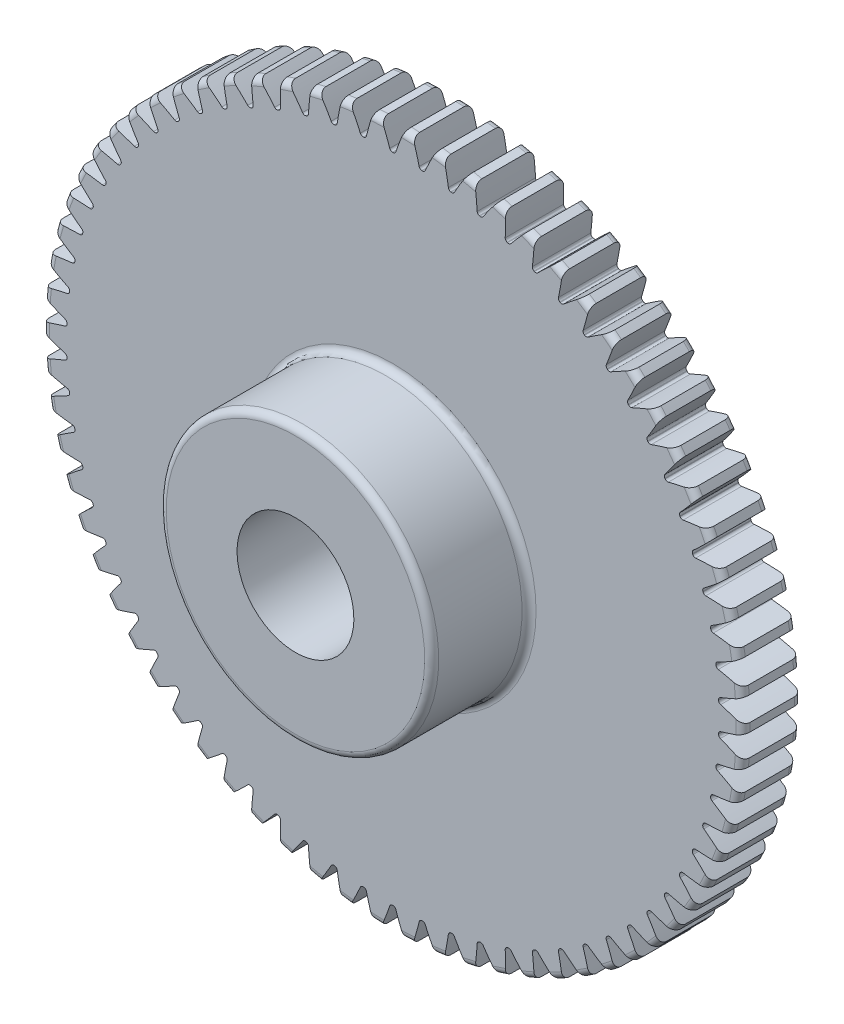
from build123d import *

# Parameters (mm, degrees)
FILLET2_R          = 0.36
CUT_EXTRUDE2_DEPTH = 26.942243542
CIRPATTERN1_COUNT  = 70


with BuildPart() as part:
    # Sketch4 → Revolve1 (revolve)
    with BuildSketch(Plane(origin=(0, 0, 0), x_dir=(0, 0, -1), z_dir=(1, 0, 0))):
        Polygon((-8, 3), (-8, 7), (-3, 7), (-3, 18), (0, 18), (0, 3), align=None)
    revolve(axis=Axis((0, 0, 3), (0, 0, 1)))

    # Fillet2
    fillet2_edges = [part.edges().sort_by_distance(p)[0] for p in [
        (0, -7, 8),
        (0, -7, 3),
        (0, -18, 3),
        (0, -18, 0),
    ]]
    fillet(fillet2_edges, radius=FILLET2_R)

    # Sketch7 → Cut-Extrude2 (cut, through all)
    with BuildSketch(Plane.XY.offset(3)):
        with BuildLine():
            ThreePointArc((-0.014085431, 16.749994078), (0, 16.75), (0.014085431, 16.749994078))
            ThreePointArc((0.014085431, 16.749994078), (0.101231883, 16.777813526), (0.156017583, 16.851073016))
            ThreePointArc((0.156017583, 16.851073016), (0.365127963, 17.424453149), (0.594105047, 17.990192861))
            ThreePointArc((0.594105047, 17.990192861), (0, 18), (-0.594105047, 17.990192861))
            ThreePointArc((-0.594105047, 17.990192861), (-0.365127963, 17.424453149), (-0.156017583, 16.851073016))
            ThreePointArc((-0.156017583, 16.851073016), (-0.101231883, 16.777813526), (-0.014085431, 16.749994078))
        make_face()
    cut_extrude2 = extrude(amount=-CUT_EXTRUDE2_DEPTH, mode=Mode.SUBTRACT)

    # CirPattern1: Cut-Extrude2 ×70 about axis
    cirpattern1_axis = Axis((0, 0, 8), (0, 0, -1))
    for i in range(1, CIRPATTERN1_COUNT):
        add(cut_extrude2.rotate(cirpattern1_axis, i * 360 / CIRPATTERN1_COUNT), mode=Mode.SUBTRACT)


solid = part.part
